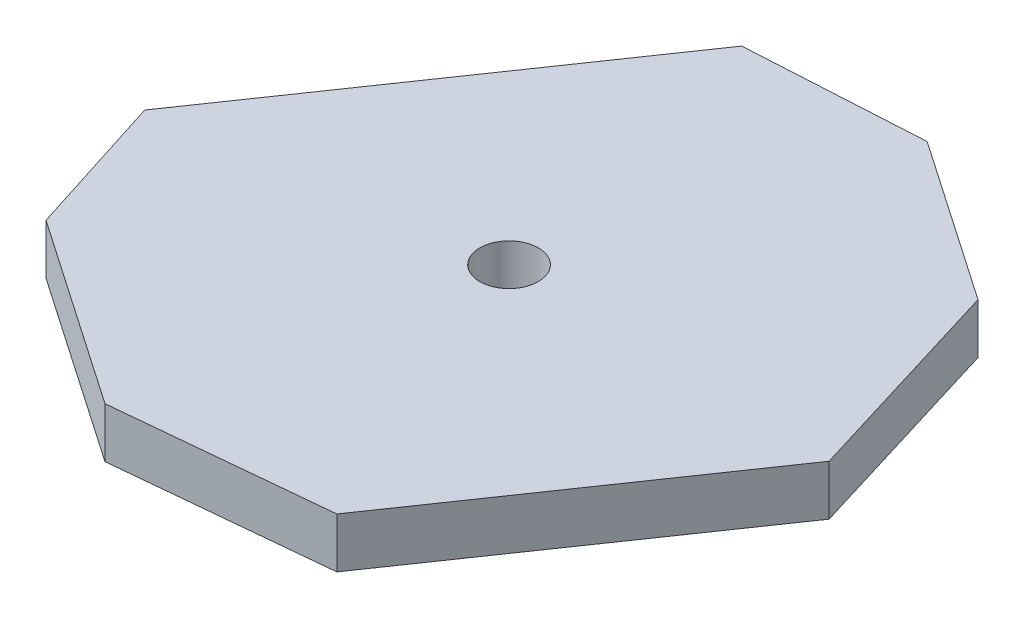
from build123d import *

# Parameters (mm, degrees)
EXTRUDE_START         = 7
SKETCH_1_R            = 40
SKETCH_1_R_2          = 9
EXTRUDE_1_DEPTH       = 13
SKETCH_12_R           = 43.016285751
SKETCH_12_R_2         = 18
CUT_EXTRUDE_5_DEPTH   = 7
CUT_EXTRUDE_5_2_DEPTH = 10
EXTRUDE_START_2       = -8
SKETCH_17_R           = 9
SKETCH_17_R_2         = 3.5
EXTRUDE_6_DEPTH       = 8
FILLET_1_R            = 7


with BuildPart() as part:
    # Эскиз1 → Вытянуть1 (new body)
    with BuildSketch(Plane(origin=(0, 0, 0), x_dir=(1, 0, 0), z_dir=(0, 1, 0)).offset(EXTRUDE_START)):
        with Locations(Location((0, 0, 0), (0, 0, 90))):
            Circle(SKETCH_1_R)
        with Locations(Location((0, 0, 0), (0, 0, 90))):
            Circle(SKETCH_1_R_2, mode=Mode.SUBTRACT)
    extrude(amount=EXTRUDE_1_DEPTH)

    # Эскиз12 → Cut-Extrude 5 (cut)
    with BuildSketch(Plane.XZ.offset(-7)):
        Circle(SKETCH_12_R)
        with Locations(Location((0, 0, 0), (0, 0, 270))):
            Circle(SKETCH_12_R_2, mode=Mode.SUBTRACT)
    extrude(amount=-CUT_EXTRUDE_5_DEPTH, mode=Mode.SUBTRACT)

    # Эскиз16 → Cut-Extrude 5 2 (cut)
    with BuildSketch(Plane(origin=(0, 20, 0), x_dir=(1, 0, 0), z_dir=(0, 1, 0))):
        Polygon((-7.191454283, -44.519977242), (-37.881198424, -24.469576927), (-45.366952085, 5.371359597), (-23.143023154, 39.387971833), (7.640311576, 44.595915214), (37.770432201, 24.911131357), (46.151265064, -5.857681321), (23.11557492, -39.392615521), align=None)
        Polygon((-8.732909884, 36.547470459), (12.235760297, 37.752192063), (31.649059452, 24.416882045), (39.477467189, -1.213541002), (15.512644169, -36.101089761), (-9.76688891, -38.545852744), (-32.285837438, -23.077221806), (-37.797558071, -5.764310018), align=None, mode=Mode.SUBTRACT)
    extrude(amount=-CUT_EXTRUDE_5_2_DEPTH, mode=Mode.SUBTRACT)

    # Эскиз17 → Вытянуть6 (add)
    with BuildSketch(Plane(origin=(0, 20, 0), x_dir=(1, 0, 0), z_dir=(0, 1, 0)).offset(EXTRUDE_START_2)):
        with Locations(Location((0, 0, 0), (0, 0, 90))):
            Circle(SKETCH_17_R)
        with Locations(Location((0, 0, 0), (0, 0, 270))):
            Circle(SKETCH_17_R_2, mode=Mode.SUBTRACT)
    extrude(amount=EXTRUDE_6_DEPTH)

    # Скругление1
    fillet_1_edges = [part.edges().sort_by_distance(p)[0] for p in [
        (0, 14, 18),
    ]]
    fillet(fillet_1_edges, radius=FILLET_1_R - 0.0001)  # a hair under: the kernel refuses the full size


solid = part.part
